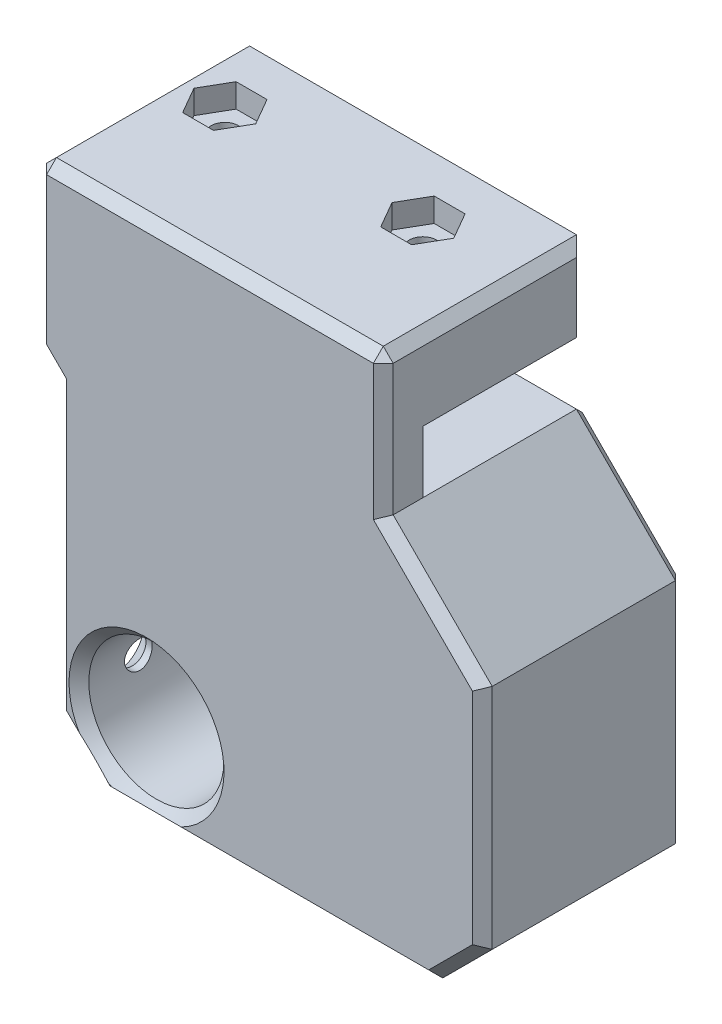
from build123d import *

# Parameters (mm, degrees)
EXTRUDE_1_DEPTH          = 5
EXTRUDE_2_DEPTH          = 4
SKETCH_3_W               = 35
SKETCH_3_H               = 8
EXTRUDE_3_DEPTH          = 16.5
EXTRUDE_4_DEPTH          = 11.5
CUT_EXTRUDE_1_DEPTH      = 62.165758395
CUT_EXTRUDE_1_DEPTH_BACK = 62.165758395
SKETCH_6_R               = 1.375
CUT_EXTRUDE_2_DEPTH      = 2.4
SKETCH_9_R               = 2.7
CUT_EXTRUDE_4_DEPTH      = 3
EXTRUDE_5_DEPTH          = 5
SKETCH_10_3_R            = 4.5
EXTRUDE_6_DEPTH          = 10
SKETCH_13_R              = 6.825
CUT_EXTRUDE_5_DEPTH      = 8
SKETCH_14_R              = 6.025
CUT_EXTRUDE_6_DEPTH      = 2.8
SKETCH_15_R              = 1.4
CUT_EXTRUDE_7_DEPTH      = 12
CHAMFER_2_SIZE           = 1
EXTRUDE_START            = 4
SKETCH_18_R              = 6.825
EXTRUDE_9_DEPTH          = 4
SKETCH_19_R              = 2.825
CUT_EXTRUDE_9_DEPTH      = 1.8
CUT_EXTRUDE_9_DRAFT      = -41


with BuildPart() as part:
    # 스케치1 → 보스-돌출1 (new body)
    with BuildSketch(Plane.XY):
        Polygon((0, 0), (0, -2), (2, -4), (2, -33), (7, -38), (40, -38), (45, -33), (45, -10), (35, 0), align=None)
    extrude(amount=-EXTRUDE_1_DEPTH)

    # 스케치2 → 보스-돌출2 (add)
    with BuildSketch(Plane.XY):
        Polygon((0, -2), (0, 14.25), (35, 14.25), (35, -4), (2, -4), align=None)
    extrude(amount=EXTRUDE_2_DEPTH)

    # 스케치3 → 보스-돌출3 (add)
    with BuildSketch(Plane(origin=(0, 0, 0), x_dir=(-1, 0, 0), z_dir=(0, 0, -1))):
        with Locations((-17.5, 10.25)):
            Rectangle(SKETCH_3_W, SKETCH_3_H)
    extrude(amount=EXTRUDE_3_DEPTH)

    # 스케치5 → 보스-돌출4 (add)
    with BuildSketch(Plane(origin=(0, 0, -5), x_dir=(-1, 0, 0), z_dir=(0, 0, -1))):
        Polygon((-35, -11.75), (-35, -38), (-40, -38), (-45, -33), (-45, -10), (-35, 0), (0, 0), (0, -2), (-2, -4), (-2, -8.75), (-32, -8.75), align=None)
    extrude(amount=EXTRUDE_4_DEPTH)

    # 스케치6 → 컷-돌출1 (cut, two sides: drawn at the far end of the back side and taken through both)
    with BuildSketch(Plane(origin=(0, 0, 0), x_dir=(1, 0, 0), z_dir=(0, 1, 0)).offset(-CUT_EXTRUDE_1_DEPTH_BACK)):
        with Locations(Location((25, 10, 0), (0, 0, 180))):
            Circle(SKETCH_6_R)
        with Locations(Location((5, 10, 0), (0, 0, 180))):
            Circle(SKETCH_6_R)
    extrude(amount=CUT_EXTRUDE_1_DEPTH + CUT_EXTRUDE_1_DEPTH_BACK, mode=Mode.SUBTRACT)

    # 스케치7 → 컷-돌출2 (cut)
    with BuildSketch(Plane(origin=(0, 14.25, 0), x_dir=(1, 0, 0), z_dir=(0, 1, 0))):
        Polygon((8.117691454, 10), (6.558845727, 12.7), (3.441154273, 12.7), (1.882308546, 10), (3.441154273, 7.3), (6.558845727, 7.3), align=None)
        Polygon((28.117691454, 10), (26.558845727, 12.7), (23.441154273, 12.7), (21.882308546, 10), (23.441154273, 7.3), (26.558845727, 7.3), align=None)
    extrude(amount=-CUT_EXTRUDE_2_DEPTH, mode=Mode.SUBTRACT)

    # 스케치9 → 컷-돌출4 (cut)
    with BuildSketch(Plane.XZ.offset(8.75)):
        with Locations((5, -10)):
            Circle(SKETCH_9_R)
        with Locations((25, -10)):
            Circle(SKETCH_9_R)
    extrude(amount=-CUT_EXTRUDE_4_DEPTH, mode=Mode.SUBTRACT)

    # 스케치10 → 보스-돌출5 (add)
    with BuildSketch(Plane(origin=(0, 0, -5), x_dir=(-1, 0, 0), z_dir=(0, 0, -1))):
        with BuildLine():
            ThreePointArc((-20.550241291, -28.5), (-23.062284829, -24.403738546), (-27.592019124, -22.800233681))
            Line((-27.592019124, -22.800233681), (-35, -22.800233681))
            Line((-35, -22.800233681), (-35, -38))
            Line((-35, -38), (-20.392252805, -38))
            Line((-20.392252805, -38), (-20.392252805, -31.5))
            Line((-20.392252805, -31.5), (-23.830038263, -31.5))
            ThreePointArc((-23.830038263, -31.5), (-31.642019124, -30), (-23.830038263, -28.5))
            Line((-23.830038263, -28.5), (-20.550241291, -28.5))
        make_face()
    extrude(amount=EXTRUDE_5_DEPTH)

    # 스케치10<3> → 보스-돌출6 (add)
    with BuildSketch(Plane(origin=(0, 0, -5), x_dir=(-1, 0, 0), z_dir=(0, 0, -1))):
        with BuildLine():
            ThreePointArc((-11.092019124, -22.25), (-16.572096678, -24.519922446), (-18.842019124, -30))
            Line((-18.842019124, -30), (-18.842019124, -38))
            Line((-18.842019124, -38), (-7, -38))
            Line((-7, -38), (-2, -33))
            Line((-2, -33), (-2, -22.25))
            Line((-2, -22.25), (-11.092019124, -22.25))
        make_face()
        with Locations((-11.092019124, -30)):
            Circle(SKETCH_10_3_R, mode=Mode.SUBTRACT)
    extrude(amount=EXTRUDE_6_DEPTH)

    # 스케치13 → 컷-돌출5 (cut)
    with BuildSketch(Plane.XY):
        with Locations((11.092019124, -30)):
            Circle(SKETCH_13_R)
    extrude(amount=-CUT_EXTRUDE_5_DEPTH, mode=Mode.SUBTRACT)

    # 스케치14 → 컷-돌출6 (cut)
    with BuildSketch(Plane.XY.offset(-8)):
        with Locations((11.092019124, -30)):
            Circle(SKETCH_14_R)
    extrude(amount=-CUT_EXTRUDE_6_DEPTH, mode=Mode.SUBTRACT)

    # 스케치15 → 컷-돌출7 (cut)
    with BuildSketch(Plane.ZY.offset(-2)):
        with Locations(Location((-2, -30, 0), (0, 0, 270))):
            Circle(SKETCH_15_R)
    extrude(amount=-CUT_EXTRUDE_7_DEPTH, mode=Mode.SUBTRACT)

    # 모따기2
    chamfer_2_edges = [part.edges().sort_by_distance(p)[0] for p in [
        (31.642019124, -30, -10),
        (15.592019124, -30, -15),
    ]]
    chamfer(chamfer_2_edges, length=CHAMFER_2_SIZE)

    # 스케치18 → 보스-돌출9 (add)
    with BuildSketch(Plane.XY.offset(EXTRUDE_START)):
        Polygon((35, 0), (35, -4), (2, -4), (2, -33), (7, -38), (40, -38), (45, -33), (45, -10), align=None)
        with Locations((11.092019124, -30)):
            Circle(SKETCH_18_R, mode=Mode.SUBTRACT)
    extrude(amount=-EXTRUDE_9_DEPTH)


with BuildPart() as cut_extrude_9_tool:
    # 스케치19 → 컷-돌출9 (with draft: the straight prism first)
    with BuildSketch(Plane.ZY.offset(-2)):
        with Locations((-2, -30)):
            Circle(SKETCH_19_R)
    extrude(amount=-CUT_EXTRUDE_9_DEPTH)
    # 컷-돌출9: the draft: its side faces are tilted about the plane it starts from
    cut_extrude_9_sides = [cut_extrude_9_tool.faces().sort_by_distance(p)[0] for p in [
        (2.9, -30, -4.825),
    ]]
    draft(cut_extrude_9_sides, Plane.ZY.offset(-2), CUT_EXTRUDE_9_DRAFT)


with BuildPart() as part_1:
    add(part.part)

    # 컷-돌출9: cut by cut_extrude_9_tool
    add(cut_extrude_9_tool.part, mode=Mode.SUBTRACT)

    # 모따기4
    # the kernel refuses this chamfer: 1 mm, written as the material it takes off along each edge
    with BuildSketch(Plane(origin=(34.333333333, 13.583333333, 3.333333333), x_dir=(-0.7071067811865475, 0.7071067811865475, 0), z_dir=(0.5773502691896258, 0.5773502691896258, 0.5773502691896258))) as chamfer_4_piece_1:
        Polygon((-0.707106781, -0.40824829), (0.707106781, -0.40824829), (0, 0.816496581), align=None)
    extrude(amount=1.270170592, mode=Mode.SUBTRACT)
    with BuildSketch(Plane(origin=(0.666666667, 13.583333333, 3.333333333), x_dir=(0.707106781186548, 0.7071067811865469, 0), z_dir=(-0.5773502691896252, 0.5773502691896261, 0.5773502691896261))) as chamfer_4_piece_2:
        Polygon((-0.707106781, 0.40824829), (0.707106781, 0.40824829), (0, -0.816496581), align=None)
    extrude(amount=1.270170592, mode=Mode.SUBTRACT)
    with BuildSketch(Plane(origin=(21.413702112, -38, -15), x_dir=(0, -0.0274958766105891, 0.9996219169112968), z_dir=(-1, 0, 0))) as chamfer_4_piece_3:
        with BuildLine():
            Line((1.028673195, 0), (-0.056547155, 1.027117794))
            Line((-0.056547155, 1.027117794), (-0.076539593, 1.026567876))
            ThreePointArc((-0.076539593, 1.026567876), (-0.034129227, 0.51339783), (-0.019992438, -0.000549918))
            Line((-0.019992438, -0.000549918), (0.000549918, -0.019992438))
            ThreePointArc((0.000549918, -0.019992438), (0.514497665, -0.00585565), (1.029223113, -0.019992438))
            Line((1.029223113, -0.019992438), (1.028673195, 0))
        make_face()
    extrude(amount=16.9853851, mode=Mode.SUBTRACT)
    with BuildSketch(Plane(origin=(8.81845448, -39.81845448, -15), x_dir=(-0.01944252080601553, -0.019442520806015537, 0.9996219169112968), z_dir=(-0.7071067811865476, 0.7071067811865475, 0)), Plane(origin=(38.18154552, -39.81845448, -16.5), x_dir=(-0.7068394360706736, 0.7068394360706736, -0.027495876610585564), z_dir=(0.7071067811865476, 0.7071067811865476, 0)), Plane(origin=(38.18154552, -39.81845448, 4), x_dir=(0.01944252080601724, -0.01944252080601724, -0.9996219169112965), z_dir=(0.7071067811865476, 0.7071067811865476, 0))) as chamfer_4_piece_4:
        with BuildLine():
            Line((1.028673195, 0), (-0.056547155, 1.027117794))
            Line((-0.056547155, 1.027117794), (-0.076539593, 1.026567876))
            ThreePointArc((-0.076539593, 1.026567876), (-0.034129227, 0.51339783), (-0.019992438, -0.000549918))
            Line((-0.019992438, -0.000549918), (0.000549918, -0.019992438))
            ThreePointArc((0.000549918, -0.019992438), (0.514497665, -0.00585565), (1.029223113, -0.019992438))
            Line((1.029223113, -0.019992438), (1.028673195, 0))
        make_face()
    extrude(amount=12.214433788, mode=Mode.SUBTRACT)
    with BuildSketch(Plane(origin=(2, -35.571682988, -15), x_dir=(0.9996219169112968, 0, -0.027495876610585623), z_dir=(0, 1, 0))) as chamfer_4_piece_5:
        with BuildLine():
            Line((1.028673195, 0), (-0.056547155, -1.027117794))
            Line((-0.056547155, -1.027117794), (-0.076539593, -1.026567876))
            ThreePointArc((-0.076539593, -1.026567876), (-0.034129227, -0.51339783), (-0.019992438, 0.000549918))
            Line((-0.019992438, 0.000549918), (0.000549918, 0.019992438))
            ThreePointArc((0.000549918, 0.019992438), (0.514497665, 0.00585565), (1.029223113, 0.019992438))
            Line((1.029223113, 0.019992438), (1.028673195, 0))
        make_face()
    extrude(amount=15.893365976, mode=Mode.SUBTRACT)
    with BuildSketch(Plane(origin=(32.428317012, -38, -16.5), x_dir=(0, -0.0274958766105891, 0.9996219169112968), z_dir=(1, 0, 0))) as chamfer_4_piece_6:
        with BuildLine():
            Line((1.028673195, 0), (-0.056547155, -1.027117794))
            Line((-0.056547155, -1.027117794), (-0.076539593, -1.026567876))
            ThreePointArc((-0.076539593, -1.026567876), (-0.034129227, -0.51339783), (-0.019992438, 0.000549918))
            Line((-0.019992438, 0.000549918), (0.000549918, 0.019992438))
            ThreePointArc((0.000549918, 0.019992438), (0.514497665, 0.00585565), (1.029223113, 0.019992438))
            Line((1.029223113, 0.019992438), (1.028673195, 0))
        make_face()
    extrude(amount=10.143365976, mode=Mode.SUBTRACT)
    with BuildSketch(Plane(origin=(2, -1.428317012, -16.5), x_dir=(0.9996219169112968, 0, -0.027495876610585623), z_dir=(0, -1, 0))) as chamfer_4_piece_7_section:
        with BuildLine():
            Line((1.028673195, 0), (-0.056547155, 1.027117794))
            Line((-0.056547155, 1.027117794), (-0.076539593, 1.026567876))
            ThreePointArc((-0.076539593, 1.026567876), (-0.034129227, 0.51339783), (-0.019992438, -0.000549918))
            Line((-0.019992438, -0.000549918), (0.000549918, -0.019992438))
            ThreePointArc((0.000549918, -0.019992438), (0.514497665, -0.00585565), (1.029223113, -0.019992438))
            Line((1.029223113, -0.019992438), (1.028673195, 0))
        make_face()
    chamfer_4_piece_7 = extrude(amount=9.893365976, mode=Mode.PRIVATE)
    chamfer_4_piece_7 = split(chamfer_4_piece_7, bisect_by=Plane(origin=(4.070954231, -6.070954231, -16.165350928), z_dir=(-0.7071067811865476, -0.7071067811865475, 0)), keep=Keep.TOP, mode=Mode.PRIVATE)
    add(chamfer_4_piece_7, mode=Mode.SUBTRACT)
    with BuildSketch(Plane(origin=(-1.81845448, -0.18154552, -16.5), x_dir=(0.7068394360706737, 0.7068394360706735, -0.027495876610585647), z_dir=(0.7071067811865475, -0.7071067811865476, 0))) as chamfer_4_piece_8_section:
        with BuildLine():
            Line((1.028673195, 0), (-0.056547155, 1.027117794))
            Line((-0.056547155, 1.027117794), (-0.076539593, 1.026567876))
            ThreePointArc((-0.076539593, 1.026567876), (-0.034129227, 0.51339783), (-0.019992438, -0.000549918))
            Line((-0.019992438, -0.000549918), (0.000549918, -0.019992438))
            ThreePointArc((0.000549918, -0.019992438), (0.514497665, -0.00585565), (1.029223113, -0.019992438))
            Line((1.029223113, -0.019992438), (1.028673195, 0))
        make_face()
    chamfer_4_piece_8 = extrude(amount=7.971793101, mode=Mode.PRIVATE)
    chamfer_4_piece_8 = split(chamfer_4_piece_8, bisect_by=Plane(origin=(2, -1.754257901, -16.163510789), z_dir=(-1, 0, 0)), keep=Keep.TOP, mode=Mode.PRIVATE)
    add(chamfer_4_piece_8, mode=Mode.SUBTRACT)
    with BuildSketch(Plane(origin=(0, 2.571682988, -16.5), x_dir=(0.9996219169112968, 0, -0.02749587661058563), z_dir=(0, -1, 0))) as chamfer_4_piece_9:
        with BuildLine():
            Line((1.028673195, 0), (-0.056547155, 1.027117794))
            Line((-0.056547155, 1.027117794), (-0.076539593, 1.026567876))
            ThreePointArc((-0.076539593, 1.026567876), (-0.034129227, 0.51339783), (-0.019992438, -0.000549918))
            Line((-0.019992438, -0.000549918), (0.000549918, -0.019992438))
            ThreePointArc((0.000549918, -0.019992438), (0.514497665, -0.00585565), (1.029223113, -0.019992438))
            Line((1.029223113, -0.019992438), (1.028673195, 0))
        make_face()
    extrude(amount=7.143365976, mode=Mode.SUBTRACT)
    with BuildSketch(Plane(origin=(37.571682988, 0, -16.5), x_dir=(0, -0.9996219169112968, -0.02749587661058563), z_dir=(-1, 0, 0)), Plane(origin=(-2.571682988, 14.25, 4), x_dir=(0, -0.9996219169112968, 0.02749587661058651), z_dir=(1, 0, 0))) as chamfer_4_piece_10:
        with BuildLine():
            Line((1.028673195, 0), (-0.056547155, 1.027117794))
            Line((-0.056547155, 1.027117794), (-0.076539593, 1.026567876))
            ThreePointArc((-0.076539593, 1.026567876), (-0.034129227, 0.51339783), (-0.019992438, -0.000549918))
            Line((-0.019992438, -0.000549918), (0.000549918, -0.019992438))
            ThreePointArc((0.000549918, -0.019992438), (0.514497665, -0.00585565), (1.029223113, -0.019992438))
            Line((1.029223113, -0.019992438), (1.028673195, 0))
        make_face()
    extrude(amount=40.143365976, mode=Mode.SUBTRACT)
    with BuildSketch(Plane(origin=(45, -35.571682988, -16.5), x_dir=(-0.9996219169112968, 0, -0.02749587661058555), z_dir=(0, 1, 0))) as chamfer_4_piece_11:
        with BuildLine():
            Line((1.028673195, 0), (-0.056547155, 1.027117794))
            Line((-0.056547155, 1.027117794), (-0.076539593, 1.026567876))
            ThreePointArc((-0.076539593, 1.026567876), (-0.034129227, 0.51339783), (-0.019992438, -0.000549918))
            Line((-0.019992438, -0.000549918), (0.000549918, -0.019992438))
            ThreePointArc((0.000549918, -0.019992438), (0.514497665, -0.00585565), (1.029223113, -0.019992438))
            Line((1.029223113, -0.019992438), (1.028673195, 0))
        make_face()
    extrude(amount=28.143365976, mode=Mode.SUBTRACT)
    with BuildSketch(Plane(origin=(46.81845448, -11.81845448, -16.5), x_dir=(-0.7068394360706728, -0.7068394360706741, -0.02749587661058559), z_dir=(-0.7071067811865482, 0.7071067811865469, 0))) as chamfer_4_piece_12:
        with BuildLine():
            Line((1.028673195, 0), (-0.056547155, 1.027117794))
            Line((-0.056547155, 1.027117794), (-0.076539593, 1.026567876))
            ThreePointArc((-0.076539593, 1.026567876), (-0.034129227, 0.51339783), (-0.019992438, -0.000549918))
            Line((-0.019992438, -0.000549918), (0.000549918, -0.019992438))
            ThreePointArc((0.000549918, -0.019992438), (0.514497665, -0.00585565), (1.029223113, -0.019992438))
            Line((1.029223113, -0.019992438), (1.028673195, 0))
        make_face()
    extrude(amount=19.2855016, mode=Mode.SUBTRACT)
    with BuildSketch(Plane(origin=(11.092019124, -30, 4), x_dir=(1, 0, 0), z_dir=(0, -1, 0))) as chamfer_4_piece_13:
        with BuildLine():
            Line((7.853284271, 0.028284271), (6.796715729, -1.028284271))
            Line((6.796715729, -1.028284271), (6.776715729, -1.028284271))
            ThreePointArc((6.776715729, -1.028284271), (6.805, -0.514142136), (6.805, 0))
            Line((6.805, 0), (6.825, 0.02))
            ThreePointArc((6.825, 0.02), (7.339142136, 0.02), (7.853284271, 0.048284271))
            Line((7.853284271, 0.048284271), (7.853284271, 0.028284271))
        make_face()
    revolve(axis=Axis((11.092019124, -30, 4), (0, 0, 1)), mode=Mode.SUBTRACT)
    with BuildSketch(Plane(origin=(35, 16.821682988, -16.5), x_dir=(0.0274958766105891, 0, 0.9996219169112968), z_dir=(0, -1, 0)), Plane(origin=(0, 3.678317012, -16.5), x_dir=(-0.0274958766105864, 0, 0.9996219169112968), z_dir=(0, 1, 0))) as chamfer_4_piece_14:
        with BuildLine():
            Line((1.028673195, 0), (-0.056547155, 1.027117794))
            Line((-0.056547155, 1.027117794), (-0.076539593, 1.026567876))
            ThreePointArc((-0.076539593, 1.026567876), (-0.034129227, 0.51339783), (-0.019992438, -0.000549918))
            Line((-0.019992438, -0.000549918), (0.000549918, -0.019992438))
            ThreePointArc((0.000549918, -0.019992438), (0.514497665, -0.00585565), (1.029223113, -0.019992438))
            Line((1.029223113, -0.019992438), (1.028673195, 0))
        make_face()
    extrude(amount=13.143365976, mode=Mode.SUBTRACT)
    with BuildSketch(Plane(origin=(3.81845448, -5.81845448, 4), x_dir=(0.7068394360706737, 0.7068394360706735, 0.027495876610586528), z_dir=(-0.7071067811865475, 0.7071067811865476, 0))) as chamfer_4_piece_15_section:
        with BuildLine():
            Line((1.028673195, 0), (-0.056547155, 1.027117794))
            Line((-0.056547155, 1.027117794), (-0.076539593, 1.026567876))
            ThreePointArc((-0.076539593, 1.026567876), (-0.034129227, 0.51339783), (-0.019992438, -0.000549918))
            Line((-0.019992438, -0.000549918), (0.000549918, -0.019992438))
            ThreePointArc((0.000549918, -0.019992438), (0.514497665, -0.00585565), (1.029223113, -0.019992438))
            Line((1.029223113, -0.019992438), (1.028673195, 0))
        make_face()
    chamfer_4_piece_15 = extrude(amount=7.971793101, mode=Mode.PRIVATE)
    chamfer_4_piece_15 = split(chamfer_4_piece_15, bisect_by=Plane(origin=(2, -1.754257901, 3.663510789), z_dir=(-1, 0, 0)), keep=Keep.TOP, mode=Mode.PRIVATE)
    add(chamfer_4_piece_15, mode=Mode.SUBTRACT)
    with BuildSketch(Plane(origin=(2, -1.428317012, 4), x_dir=(0.9996219169112968, 0, 0.027495876610586487), z_dir=(0, -1, 0))) as chamfer_4_piece_16_section:
        with BuildLine():
            Line((1.028673195, 0), (-0.056547155, -1.027117794))
            Line((-0.056547155, -1.027117794), (-0.076539593, -1.026567876))
            ThreePointArc((-0.076539593, -1.026567876), (-0.034129227, -0.51339783), (-0.019992438, 0.000549918))
            Line((-0.019992438, 0.000549918), (0.000549918, 0.019992438))
            ThreePointArc((0.000549918, 0.019992438), (0.514497665, 0.00585565), (1.029223113, 0.019992438))
            Line((1.029223113, 0.019992438), (1.028673195, 0))
        make_face()
    chamfer_4_piece_16 = extrude(amount=34.143365976, mode=Mode.PRIVATE)
    chamfer_4_piece_16 = split(chamfer_4_piece_16, bisect_by=Plane(origin=(10.13874151, -12.13874151, 3.669119732), z_dir=(-0.7071067811865476, -0.7071067811865475, 0)), keep=Keep.TOP, mode=Mode.PRIVATE)
    add(chamfer_4_piece_16, mode=Mode.SUBTRACT)
    with BuildSketch(Plane(origin=(0.18154552, -31.18154552, 4), x_dir=(0.7068394360706735, 0.7068394360706737, 0.027495876610586552), z_dir=(0.7071067811865476, -0.7071067811865475, 0))) as chamfer_4_piece_17:
        with BuildLine():
            Line((1.028673195, 0), (-0.056547155, -1.027117794))
            Line((-0.056547155, -1.027117794), (-0.076539593, -1.026567876))
            ThreePointArc((-0.076539593, -1.026567876), (-0.034129227, -0.51339783), (-0.019992438, 0.000549918))
            Line((-0.019992438, 0.000549918), (0.000549918, 0.019992438))
            ThreePointArc((0.000549918, 0.019992438), (0.514497665, 0.00585565), (1.029223113, 0.019992438))
            Line((1.029223113, 0.019992438), (1.028673195, 0))
        make_face()
    extrude(amount=12.214433788, mode=Mode.SUBTRACT)
    with BuildSketch(Plane(origin=(4.428317012, -38, 4), x_dir=(0, -0.02749587661058907, -0.9996219169112965), z_dir=(1, 0, 0))) as chamfer_4_piece_18:
        with BuildLine():
            Line((1.028673195, 0), (-0.056547155, 1.027117794))
            Line((-0.056547155, 1.027117794), (-0.076539593, 1.026567876))
            ThreePointArc((-0.076539593, 1.026567876), (-0.034129227, 0.51339783), (-0.019992438, -0.000549918))
            Line((-0.019992438, -0.000549918), (0.000549918, -0.019992438))
            ThreePointArc((0.000549918, -0.019992438), (0.514497665, -0.00585565), (1.029223113, -0.019992438))
            Line((1.029223113, -0.019992438), (1.028673195, 0))
        make_face()
    extrude(amount=38.143365976, mode=Mode.SUBTRACT)
    with BuildSketch(Plane(origin=(45, -35.571682988, 4), x_dir=(-0.9996219169112968, 0, 0.027495876610586414), z_dir=(0, 1, 0))) as chamfer_4_piece_19:
        with BuildLine():
            Line((1.028673195, 0), (-0.056547155, -1.027117794))
            Line((-0.056547155, -1.027117794), (-0.076539593, -1.026567876))
            ThreePointArc((-0.076539593, -1.026567876), (-0.034129227, -0.51339783), (-0.019992438, 0.000549918))
            Line((-0.019992438, 0.000549918), (0.000549918, 0.019992438))
            ThreePointArc((0.000549918, 0.019992438), (0.514497665, 0.00585565), (1.029223113, 0.019992438))
            Line((1.029223113, 0.019992438), (1.028673195, 0))
        make_face()
    extrude(amount=28.143365976, mode=Mode.SUBTRACT)
    with BuildSketch(Plane(origin=(46.81845448, -11.81845448, 4), x_dir=(-0.7068394360706728, -0.7068394360706741, 0.027495876610586455), z_dir=(-0.7071067811865482, 0.7071067811865469, 0))) as chamfer_4_piece_20_section:
        with BuildLine():
            Line((1.028673195, 0), (-0.056547155, -1.027117794))
            Line((-0.056547155, -1.027117794), (-0.076539593, -1.026567876))
            ThreePointArc((-0.076539593, -1.026567876), (-0.034129227, -0.51339783), (-0.019992438, 0.000549918))
            Line((-0.019992438, 0.000549918), (0.000549918, 0.019992438))
            ThreePointArc((0.000549918, 0.019992438), (0.514497665, 0.00585565), (1.029223113, 0.019992438))
            Line((1.029223113, 0.019992438), (1.028673195, 0))
        make_face()
    chamfer_4_piece_20 = extrude(amount=19.2855016, mode=Mode.PRIVATE)
    chamfer_4_piece_20 = split(chamfer_4_piece_20, bisect_by=Plane(origin=(35, -6.254915211, 3.66813431), z_dir=(1, 0, 0)), keep=Keep.TOP, mode=Mode.PRIVATE)
    add(chamfer_4_piece_20, mode=Mode.SUBTRACT)
    with BuildSketch(Plane(origin=(35, 14.25, 6.571682988), x_dir=(0.0274958766105891, -0.9996219169112968, 0), z_dir=(0, 0, -1))) as chamfer_4_piece_21:
        with BuildLine():
            Line((1.028673195, 0), (-0.056547155, 1.027117794))
            Line((-0.056547155, 1.027117794), (-0.076539593, 1.026567876))
            ThreePointArc((-0.076539593, 1.026567876), (-0.034129227, 0.51339783), (-0.019992438, -0.000549918))
            Line((-0.019992438, -0.000549918), (0.000549918, -0.019992438))
            ThreePointArc((0.000549918, -0.019992438), (0.514497665, -0.00585565), (1.029223113, -0.019992438))
            Line((1.029223113, -0.019992438), (1.028673195, 0))
        make_face()
    extrude(amount=25.643365976, mode=Mode.SUBTRACT)
    with BuildSketch(Plane(origin=(35, 16.821682988, 4), x_dir=(-0.9996219169112968, 0, 0.027495876610586414), z_dir=(0, -1, 0))) as chamfer_4_piece_22_section:
        with BuildLine():
            Line((1.028673195, 0), (-0.056547155, 1.027117794))
            Line((-0.056547155, 1.027117794), (-0.076539593, 1.026567876))
            ThreePointArc((-0.076539593, 1.026567876), (-0.034129227, 0.51339783), (-0.019992438, -0.000549918))
            Line((-0.019992438, -0.000549918), (0.000549918, -0.019992438))
            ThreePointArc((0.000549918, -0.019992438), (0.514497665, -0.00585565), (1.029223113, -0.019992438))
            Line((1.029223113, -0.019992438), (1.028673195, 0))
        make_face()
    chamfer_4_piece_22 = extrude(amount=19.393365976, mode=Mode.PRIVATE)
    chamfer_4_piece_22 = split(chamfer_4_piece_22, bisect_by=Plane(origin=(30.550121932, 4.449878068, 3.668147862), z_dir=(0.7071067811865469, 0.7071067811865482, 0)), keep=Keep.TOP, mode=Mode.PRIVATE)
    add(chamfer_4_piece_22, mode=Mode.SUBTRACT)
    with BuildSketch(Plane(origin=(0, 14.25, 6.571682988), x_dir=(-0.02749587661058627, -0.9996219169112968, 0), z_dir=(0, 0, -1))) as chamfer_4_piece_23:
        with BuildLine():
            Line((1.028673195, 0), (-0.056547155, -1.027117794))
            Line((-0.056547155, -1.027117794), (-0.076539593, -1.026567876))
            ThreePointArc((-0.076539593, -1.026567876), (-0.034129227, -0.51339783), (-0.019992438, 0.000549918))
            Line((-0.019992438, 0.000549918), (0.000549918, 0.019992438))
            ThreePointArc((0.000549918, 0.019992438), (0.514497665, 0.00585565), (1.029223113, 0.019992438))
            Line((1.029223113, 0.019992438), (1.028673195, 0))
        make_face()
    extrude(amount=25.643365976, mode=Mode.SUBTRACT)
    with BuildSketch(Plane(origin=(0, -4.571682988, 4), x_dir=(0.9996219169112968, 0, 0.027495876610586494), z_dir=(0, 1, 0))) as chamfer_4_piece_24:
        with BuildLine():
            Line((1.028673195, 0), (-0.056547155, 1.027117794))
            Line((-0.056547155, 1.027117794), (-0.076539593, 1.026567876))
            ThreePointArc((-0.076539593, 1.026567876), (-0.034129227, 0.51339783), (-0.019992438, -0.000549918))
            Line((-0.019992438, -0.000549918), (0.000549918, -0.019992438))
            ThreePointArc((0.000549918, -0.019992438), (0.514497665, -0.00585565), (1.029223113, -0.019992438))
            Line((1.029223113, -0.019992438), (1.028673195, 0))
        make_face()
    extrude(amount=21.393365976, mode=Mode.SUBTRACT)
    with BuildSketch(Plane(origin=(-1.81845448, -0.18154552, -16.5), x_dir=(0.7068394360706737, 0.7068394360706735, -0.027495876610585647), z_dir=(0.7071067811865475, -0.7071067811865476, 0))) as chamfer_4_piece_25a_section:
        with BuildLine():
            Line((1.028673195, 0), (-0.056547155, 1.027117794))
            Line((-0.056547155, 1.027117794), (-0.076539593, 1.026567876))
            ThreePointArc((-0.076539593, 1.026567876), (-0.034129227, 0.51339783), (-0.019992438, -0.000549918))
            Line((-0.019992438, -0.000549918), (0.000549918, -0.019992438))
            ThreePointArc((0.000549918, -0.019992438), (0.514497665, -0.00585565), (1.029223113, -0.019992438))
            Line((1.029223113, -0.019992438), (1.028673195, 0))
        make_face()
    chamfer_4_piece_25a = extrude(amount=7.971793101, mode=Mode.PRIVATE)
    chamfer_4_piece_25a = split(chamfer_4_piece_25a, bisect_by=Plane(origin=(2, -4.536214365, -16.181906875), z_dir=(1, 0, 0)), keep=Keep.TOP, mode=Mode.PRIVATE)
    with BuildSketch(Plane(origin=(2, -1.428317012, -16.5), x_dir=(0.9996219169112968, 0, -0.027495876610585623), z_dir=(0, -1, 0))) as chamfer_4_piece_25b_section:
        with BuildLine():
            Line((1.028673195, 0), (-0.056547155, 1.027117794))
            Line((-0.056547155, 1.027117794), (-0.076539593, 1.026567876))
            ThreePointArc((-0.076539593, 1.026567876), (-0.034129227, 0.51339783), (-0.019992438, -0.000549918))
            Line((-0.019992438, -0.000549918), (0.000549918, -0.019992438))
            ThreePointArc((0.000549918, -0.019992438), (0.514497665, -0.00585565), (1.029223113, -0.019992438))
            Line((1.029223113, -0.019992438), (1.028673195, 0))
        make_face()
    chamfer_4_piece_25b = extrude(amount=9.893365976, mode=Mode.PRIVATE)
    chamfer_4_piece_25b = split(chamfer_4_piece_25b, bisect_by=Plane(origin=(1.620839187, -3.620839187, -16.181906875), z_dir=(0.7071067811865476, 0.7071067811865475, 0)), keep=Keep.TOP, mode=Mode.PRIVATE)
    chamfer_4_piece_25 = chamfer_4_piece_25a & chamfer_4_piece_25b
    add(chamfer_4_piece_25, mode=Mode.SUBTRACT)
    with BuildSketch(Plane(origin=(2, -1.428317012, 4), x_dir=(0.9996219169112968, 0, 0.027495876610586487), z_dir=(0, -1, 0))) as chamfer_4_piece_26a_section:
        with BuildLine():
            Line((1.028673195, 0), (-0.056547155, -1.027117794))
            Line((-0.056547155, -1.027117794), (-0.076539593, -1.026567876))
            ThreePointArc((-0.076539593, -1.026567876), (-0.034129227, -0.51339783), (-0.019992438, 0.000549918))
            Line((-0.019992438, 0.000549918), (0.000549918, 0.019992438))
            ThreePointArc((0.000549918, 0.019992438), (0.514497665, 0.00585565), (1.029223113, 0.019992438))
            Line((1.029223113, 0.019992438), (1.028673195, 0))
        make_face()
    chamfer_4_piece_26a = extrude(amount=34.143365976, mode=Mode.PRIVATE)
    chamfer_4_piece_26a = split(chamfer_4_piece_26a, bisect_by=Plane(origin=(1.620839187, -3.620839187, 3.681906875), z_dir=(0.7071067811865476, 0.7071067811865475, 0)), keep=Keep.TOP, mode=Mode.PRIVATE)
    with BuildSketch(Plane(origin=(3.81845448, -5.81845448, 4), x_dir=(0.7068394360706737, 0.7068394360706735, 0.027495876610586528), z_dir=(-0.7071067811865475, 0.7071067811865476, 0))) as chamfer_4_piece_26b_section:
        with BuildLine():
            Line((1.028673195, 0), (-0.056547155, 1.027117794))
            Line((-0.056547155, 1.027117794), (-0.076539593, 1.026567876))
            ThreePointArc((-0.076539593, 1.026567876), (-0.034129227, 0.51339783), (-0.019992438, -0.000549918))
            Line((-0.019992438, -0.000549918), (0.000549918, -0.019992438))
            ThreePointArc((0.000549918, -0.019992438), (0.514497665, -0.00585565), (1.029223113, -0.019992438))
            Line((1.029223113, -0.019992438), (1.028673195, 0))
        make_face()
    chamfer_4_piece_26b = extrude(amount=7.971793101, mode=Mode.PRIVATE)
    chamfer_4_piece_26b = split(chamfer_4_piece_26b, bisect_by=Plane(origin=(2, -4.536214365, 3.681906875), z_dir=(1, 0, 0)), keep=Keep.TOP, mode=Mode.PRIVATE)
    chamfer_4_piece_26 = chamfer_4_piece_26a & chamfer_4_piece_26b
    add(chamfer_4_piece_26, mode=Mode.SUBTRACT)
    with BuildSketch(Plane(origin=(46.81845448, -11.81845448, 4), x_dir=(-0.7068394360706728, -0.7068394360706741, 0.027495876610586455), z_dir=(-0.7071067811865482, 0.7071067811865469, 0))) as chamfer_4_piece_27a_section:
        with BuildLine():
            Line((1.028673195, 0), (-0.056547155, -1.027117794))
            Line((-0.056547155, -1.027117794), (-0.076539593, -1.026567876))
            ThreePointArc((-0.076539593, -1.026567876), (-0.034129227, -0.51339783), (-0.019992438, 0.000549918))
            Line((-0.019992438, 0.000549918), (0.000549918, 0.019992438))
            ThreePointArc((0.000549918, 0.019992438), (0.514497665, 0.00585565), (1.029223113, 0.019992438))
            Line((1.029223113, 0.019992438), (1.028673195, 0))
        make_face()
    chamfer_4_piece_27a = extrude(amount=19.2855016, mode=Mode.PRIVATE)
    chamfer_4_piece_27a = split(chamfer_4_piece_27a, bisect_by=Plane(origin=(35, 0.536214365, 3.681906875), z_dir=(-1, 0, 0)), keep=Keep.TOP, mode=Mode.PRIVATE)
    with BuildSketch(Plane(origin=(35, 16.821682988, 4), x_dir=(-0.9996219169112968, 0, 0.027495876610586414), z_dir=(0, -1, 0))) as chamfer_4_piece_27b_section:
        with BuildLine():
            Line((1.028673195, 0), (-0.056547155, 1.027117794))
            Line((-0.056547155, 1.027117794), (-0.076539593, 1.026567876))
            ThreePointArc((-0.076539593, 1.026567876), (-0.034129227, 0.51339783), (-0.019992438, -0.000549918))
            Line((-0.019992438, -0.000549918), (0.000549918, -0.019992438))
            ThreePointArc((0.000549918, -0.019992438), (0.514497665, -0.00585565), (1.029223113, -0.019992438))
            Line((1.029223113, -0.019992438), (1.028673195, 0))
        make_face()
    chamfer_4_piece_27b = extrude(amount=19.393365976, mode=Mode.PRIVATE)
    chamfer_4_piece_27b = split(chamfer_4_piece_27b, bisect_by=Plane(origin=(35.379160813, -0.379160813, 3.681906875), z_dir=(-0.7071067811865469, -0.7071067811865482, 0)), keep=Keep.TOP, mode=Mode.PRIVATE)
    chamfer_4_piece_27 = chamfer_4_piece_27a & chamfer_4_piece_27b
    add(chamfer_4_piece_27, mode=Mode.SUBTRACT)


solid = part_1.part
